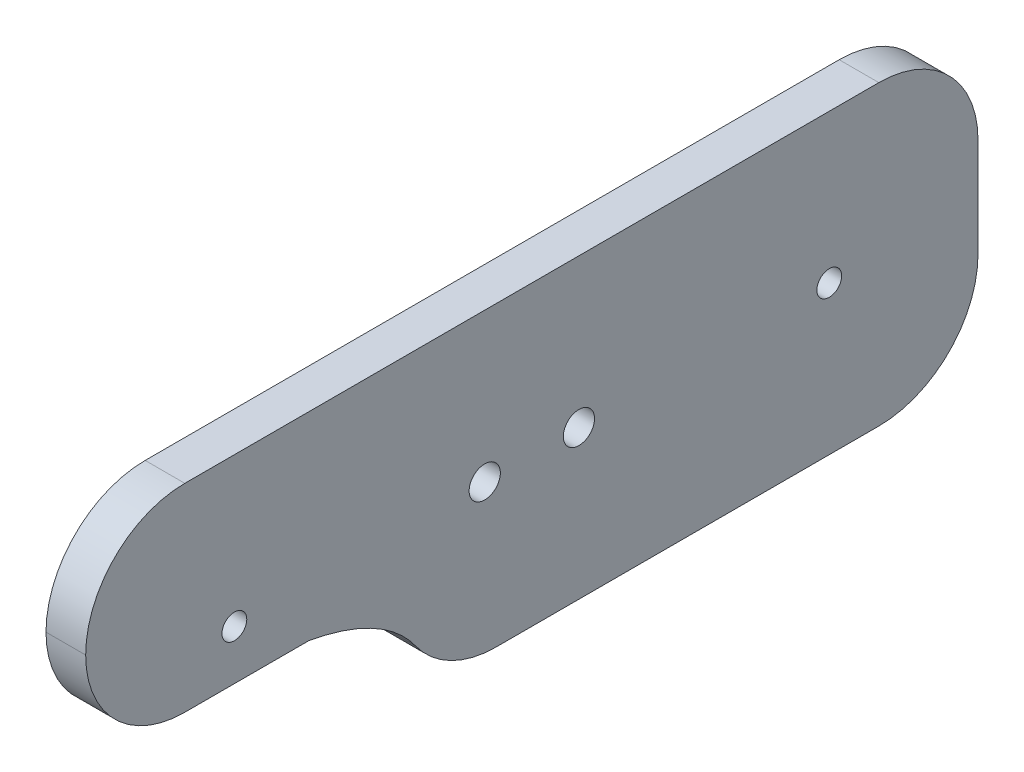
from build123d import *

# Parameters (mm, degrees)
SKETCH1_W           = 90
SKETCH1_H           = 30
BOSS_EXTRUDE1_DEPTH = 4
SKETCH6_R           = 1.575
CUT_EXTRUDE6_DEPTH  = 48.602520942
SKETCH7_R           = 1.575
CUT_EXTRUDE7_DEPTH  = 48.602520942
SKETCH13_R          = 1.25
CUT_EXTRUDE13_DEPTH = 48.602520942
SKETCH14_R          = 1.25
CUT_EXTRUDE14_DEPTH = 48.602520942
SKETCH15_W          = 15
SKETCH15_H          = 10
CUT_EXTRUDE15_DEPTH = 48.602520942
FILLET1_R           = 10
SKETCH16_W          = 20
SKETCH16_H          = 10
CUT_EXTRUDE16_DEPTH = 48.602520942
FILLET2_R           = 10
BOSS_EXTRUDE2_DEPTH = 4
FILLET3_R           = 10


with BuildPart() as part:
    # Sketch1 → Boss-Extrude1 (new body)
    with BuildSketch(Plane(origin=(0, 0, 0), x_dir=(0, 0, -1), z_dir=(1, 0, 0))):
        Rectangle(SKETCH1_W, SKETCH1_H)
    extrude(amount=BOSS_EXTRUDE1_DEPTH)

    # Sketch6 → Cut-Extrude6 (cut, through all)
    with BuildSketch(Plane(origin=(4, 0, 0), x_dir=(0, 0, -1), z_dir=(1, 0, 0))):
        with Locations((-4.75, 0)):
            Circle(SKETCH6_R)
    extrude(amount=-CUT_EXTRUDE6_DEPTH, mode=Mode.SUBTRACT)

    # Sketch7 → Cut-Extrude7 (cut, through all)
    with BuildSketch(Plane(origin=(4, 0, 0), x_dir=(0, 0, -1), z_dir=(1, 0, 0))):
        with Locations((4.75, 0)):
            Circle(SKETCH7_R)
    extrude(amount=-CUT_EXTRUDE7_DEPTH, mode=Mode.SUBTRACT)

    # Sketch13 → Cut-Extrude13 (cut, through all)
    with BuildSketch(Plane(origin=(4, 0, 0), x_dir=(0, 0, -1), z_dir=(1, 0, 0))):
        with Locations((-30, 0)):
            Circle(SKETCH13_R)
    extrude(amount=-CUT_EXTRUDE13_DEPTH, mode=Mode.SUBTRACT)

    # Sketch14 → Cut-Extrude14 (cut, through all)
    with BuildSketch(Plane(origin=(4, 0, 0), x_dir=(0, 0, -1), z_dir=(1, 0, 0))):
        with Locations((30, 0)):
            Circle(SKETCH14_R)
    extrude(amount=-CUT_EXTRUDE14_DEPTH, mode=Mode.SUBTRACT)

    # Sketch15 → Cut-Extrude15 (cut, through all)
    with BuildSketch(Plane(origin=(4, 0, 0), x_dir=(0, 0, -1), z_dir=(1, 0, 0))):
        with Locations((-37.5, -10)):
            Rectangle(SKETCH15_W, SKETCH15_H)
    extrude(amount=-CUT_EXTRUDE15_DEPTH, mode=Mode.SUBTRACT)

    # Fillet1
    fillet1_edges = [part.edges().sort_by_distance(p)[0] for p in [
        (2, -15, -45),
        (2, 15, 45),
        (2, 15, -45),
    ]]
    fillet(fillet1_edges, radius=FILLET1_R)

    # Sketch16 → Cut-Extrude16 (cut, through all)
    with BuildSketch(Plane(origin=(4, 0, 0), x_dir=(0, 0, -1), z_dir=(1, 0, 0))):
        with Locations((-20, -10)):
            Rectangle(SKETCH16_W, SKETCH16_H)
    extrude(amount=-CUT_EXTRUDE16_DEPTH, mode=Mode.SUBTRACT)

    # Fillet2
    fillet2_edges = [part.edges().sort_by_distance(p)[0] for p in [
        (2, -5, 45),
    ]]
    fillet(fillet2_edges, radius=FILLET2_R - 0.0001)  # a hair under: the kernel refuses the full size

    # Sketch17 → Boss-Extrude2 (add)
    with BuildSketch(Plane(origin=(4, 0, 0), x_dir=(0, 0, -1), z_dir=(1, 0, 0))):
        with BuildLine():
            Line((-22.5, -5), (-10, -5))
            Line((-10, -5), (-10, -15))
            add(Edge.make_bspline(
                [(-10, -15), (-10.926575713, -9.745128006), (-15.532860799, -6.228494619), (-22.5, -5)],
                knots=[0, 0, 0, 0, 1, 1, 1, 1], degree=3))
        make_face()
    extrude(amount=-BOSS_EXTRUDE2_DEPTH)

    # Fillet3
    fillet3_edges = [part.edges().sort_by_distance(p)[0] for p in [
        (2, -15, 10),
    ]]
    fillet(fillet3_edges, radius=FILLET3_R)


solid = part.part
